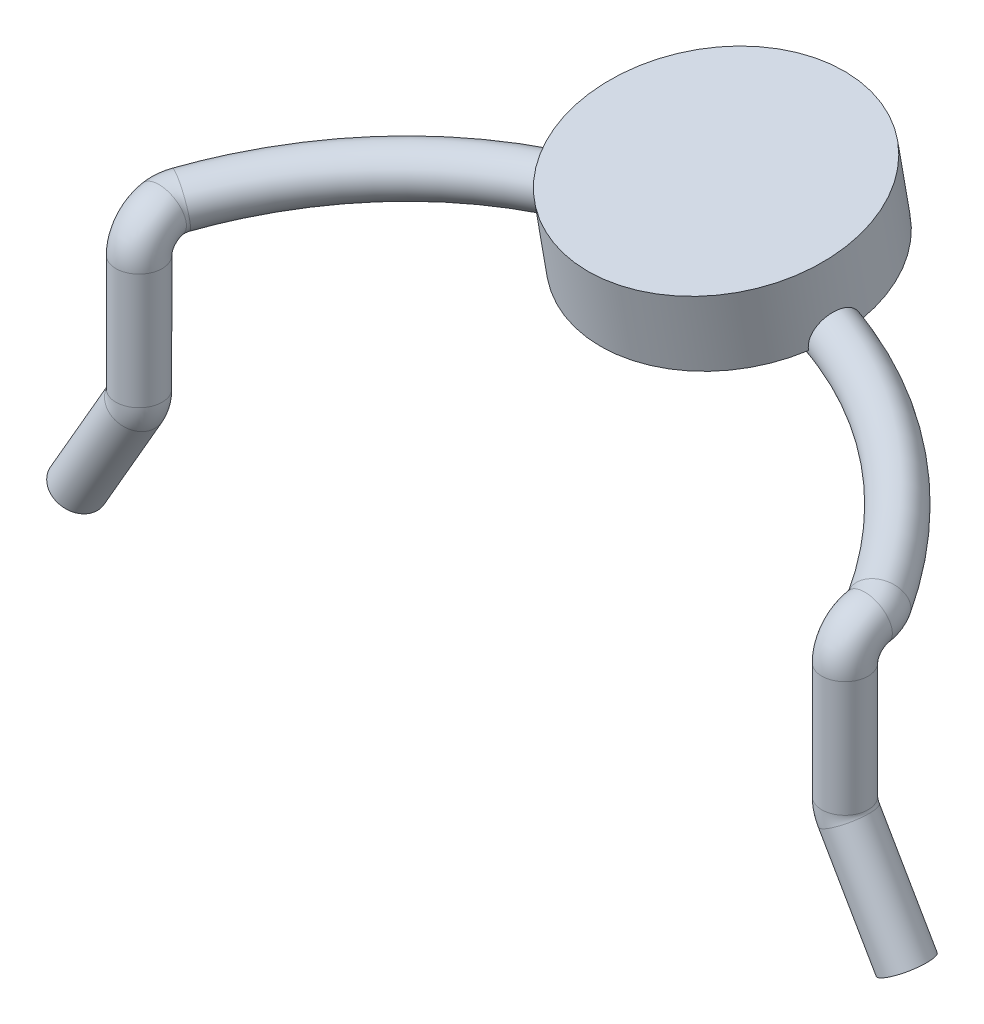
from build123d import *

# Parameters (mm, degrees)
SKETCH1_R             = 0.4
BOSS_EXTRUDE1_DEPTH   = 2
BOSS_EXTRUDE1_2_DEPTH = 2
SKETCH2_R             = 0.4
REVOLVE4_ANGLE        = 80
SKETCH3_R             = 0.4
REVOLVE5_ANGLE        = 30
SKETCH4_R             = 0.4
REVOLVE6_ANGLE        = 30
SKETCH11_R            = 0.4
SKETCH12_R            = 2.25
BOSS_EXTRUDE2_DEPTH   = 1.25
SKETCH13_R            = 0.4
REVOLVE7_ANGLE        = 30
SKETCH14_R            = 0.4
BOSS_EXTRUDE3_DEPTH   = 2


with BuildPart() as part:
    # Sketch1 → Boss-Extrude1 (new body)
    with BuildSketch(Plane(origin=(0, 0, 0), x_dir=(1, 0, 0), z_dir=(0, 1, 0))):
        with Locations((-6.1, 0)):
            Circle(SKETCH1_R)
    extrude(amount=-BOSS_EXTRUDE1_DEPTH)



with BuildPart() as body_2:
    # Sketch1 → Boss-Extrude1 2 (new body)
    with BuildSketch(Plane(origin=(0, 0, 0), x_dir=(1, 0, 0), z_dir=(0, 1, 0))):
        with Locations((6.1, 0)):
            Circle(SKETCH1_R)
    extrude(amount=-BOSS_EXTRUDE1_2_DEPTH)


with BuildPart() as part_1:
    add(part.part)

    add(body_2.part)  # Revolve4 merges body 2
    # Sketch2 → Revolve4 (revolve)
    with BuildSketch(Plane(origin=(0, 0, 0), x_dir=(1, 0, 0), z_dir=(0, 1, 0))):
        with Locations((6.1, 0)):
            Circle(SKETCH2_R)
        with Locations((-6.1, 0)):
            Circle(SKETCH2_R)
    revolve(axis=Axis((-6.5, 0, -0.5), (-1, 0, 0)), revolution_arc=REVOLVE4_ANGLE)

    # Sketch3 → Revolve5 (revolve)
    with BuildSketch(Plane(origin=(0, 0.085505036, -0.484923155), x_dir=(-1, 0, 0), z_dir=(0, 0.17364817766692736, -0.9848077530122086))):
        with Locations((-6.1, 0.413175911)):
            Circle(SKETCH3_R)
    revolve(axis=Axis((5.6, 0.982265488, -0.326800092), (0, 0.9848077530122086, 0.1736481776669274)), revolution_arc=REVOLVE5_ANGLE)

    # Sketch4 → Revolve6 (revolve)
    with BuildSketch(Plane(origin=(0, 0.085505036, -0.484923155), x_dir=(-1, 0, 0), z_dir=(0, 0.17364817766692736, -0.9848077530122086))):
        with Locations((6.1, 0.413175911)):
            Circle(SKETCH4_R)
    revolve(axis=Axis((-5.6, 1.037409724, -0.317076676), (0, -0.9848077530122086, -0.17364817766692733)), revolution_arc=REVOLVE6_ANGLE)

    # Sweep1: sweep along a path in Sketch5
    with BuildLine(Plane(origin=(0, 0.406898841, 0.071747244), x_dir=(1, 0, 0), z_dir=(0, 0.984807753012208, 0.17364817766693072))) as sweep1_path:
        ThreePointArc((-6.033012702, 0.742403877), (0, 4.225565384), (6.033012702, 0.742403877))
    # Sketch11 → Sweep1 (sweep)
    with BuildSketch(Plane(origin=(-1.186782867, -0.356945676, 2.024339523), x_dir=(-0.8402936458397423, -0.15403461860121453, -0.5197883463812287), z_dir=(0.5000000000000008, 0.15038373318043258, -0.8528685319524433))):
        with Locations((5.32970496, 1.754864912)):
            Circle(SKETCH11_R)
    sweep(path=sweep1_path.line)

    # Sketch12 → Boss-Extrude2 (add)
    with BuildSketch(Plane(origin=(0, 0.406898841, 0.071747244), x_dir=(1, 0, 0), z_dir=(0, 0.984807753012208, 0.17364817766693072))):
        with Locations((0, 4.225565384)):
            Circle(SKETCH12_R)
    extrude(amount=BOSS_EXTRUDE2_DEPTH)

    # Sketch13 → Revolve7 (revolve)
    with BuildSketch(Plane.XZ.offset(2)):
        with Locations((6.1, 0)):
            Circle(SKETCH13_R)
    revolve7 = revolve(axis=Axis((6.6, -2, -0.291841751), (0, 0, 1)), revolution_arc=REVOLVE7_ANGLE)

    # Sketch14 → Boss-Extrude3 (add)
    with BuildSketch(Plane(origin=(2.516025404, -4.357883832, 0), x_dir=(0.866025403784438, 0.500000000000001, 0), z_dir=(0.500000000000001, -0.866025403784438, 0))):
        with Locations((4.215767665, 0)):
            Circle(SKETCH14_R)
    boss_extrude3 = extrude(amount=BOSS_EXTRUDE3_DEPTH)

    # Mirror1: Revolve7, Boss-Extrude3 across plane
    add(revolve7.mirror(Plane(origin=(0, 0, 0), x_dir=(0, 0, 1), z_dir=(1, 0, 0))))
    add(boss_extrude3.mirror(Plane(origin=(0, 0, 0), x_dir=(0, 0, 1), z_dir=(1, 0, 0))))


solid = part_1.part
